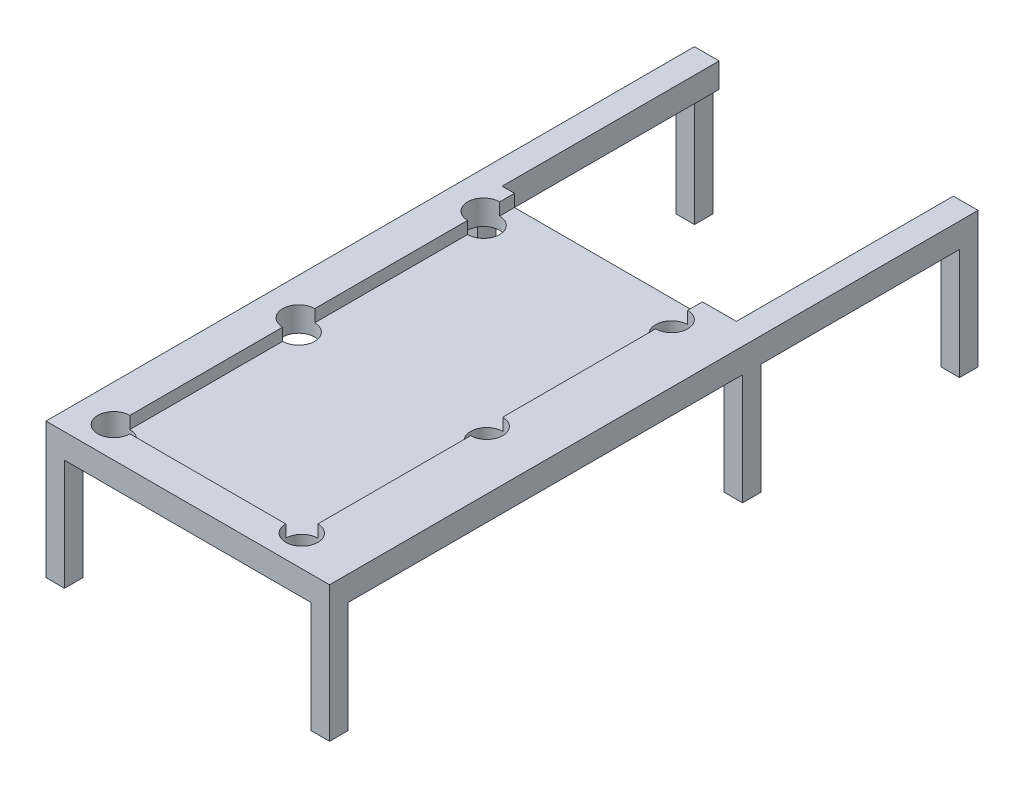
from build123d import *

# Parameters (mm, degrees)
SKETCH2_W           = 460
SKETCH2_H           = 700
SKETCH2_W_2         = 305
SKETCH2_H_2         = 600
BOSS_EXTRUDE1_DEPTH = 20
SKETCH10_W          = 460
SKETCH10_H          = 700
BOSS_EXTRUDE6_DEPTH = 20
SKETCH11_W          = 30
SKETCH11_H          = 30
BOSS_EXTRUDE7_DEPTH = 180
SKETCH14_W          = 40
SKETCH14_H          = 352
BOSS_EXTRUDE8_DEPTH = 40
SKETCH15_W          = 30
SKETCH15_H          = 30
BOSS_EXTRUDE9_DEPTH = 180
SKETCH17_R          = 26
CUT_EXTRUDE1_DEPTH  = 60
CUT_EXTRUDE2_DEPTH  = 20


with BuildPart() as part:
    # Sketch2 → Boss-Extrude1 (new body)
    with BuildSketch(Plane(origin=(0, 0, 0), x_dir=(1, 0, 0), z_dir=(0, 1, 0))):
        with Locations((230, 350)):
            Rectangle(SKETCH2_W, SKETCH2_H)
        with Locations((212.5, 350)):
            Rectangle(SKETCH2_W_2, SKETCH2_H_2, mode=Mode.SUBTRACT)
    extrude(amount=BOSS_EXTRUDE1_DEPTH)

    # Sketch10 → Boss-Extrude6 (add)
    with BuildSketch(Plane.XZ):
        with Locations((230, -350)):
            Rectangle(SKETCH10_W, SKETCH10_H)
    extrude(amount=BOSS_EXTRUDE6_DEPTH)

    # Sketch11 → Boss-Extrude7 (add)
    with BuildSketch(Plane.XZ.offset(20)):
        with Locations((15, -15)):
            Rectangle(SKETCH11_W, SKETCH11_H)
        with Locations((445, -15)):
            Rectangle(SKETCH11_W, SKETCH11_H)
        with Locations((15, -685)):
            Rectangle(SKETCH11_W, SKETCH11_H)
        with Locations((445, -685)):
            Rectangle(SKETCH11_W, SKETCH11_H)
    extrude(amount=BOSS_EXTRUDE7_DEPTH)

    # Sketch14 → Boss-Extrude8 (add)
    with BuildSketch(Plane(origin=(0, 20, 0), x_dir=(1, 0, 0), z_dir=(0, 1, 0))):
        with Locations((20, 876)):
            Rectangle(SKETCH14_W, SKETCH14_H)
        with Locations((440, 876)):
            Rectangle(SKETCH14_W, SKETCH14_H)
    extrude(amount=-BOSS_EXTRUDE8_DEPTH)

    # Sketch15 → Boss-Extrude9 (add)
    with BuildSketch(Plane.XZ.offset(20)):
        with Locations((445, -1037)):
            Rectangle(SKETCH15_W, SKETCH15_H)
        with Locations((15, -1037)):
            Rectangle(SKETCH15_W, SKETCH15_H)
    extrude(amount=BOSS_EXTRUDE9_DEPTH)

    # Sketch17 → Cut-Extrude1 (cut)
    with BuildSketch(Plane(origin=(0, 20, 0), x_dir=(1, 0, 0), z_dir=(0, 1, 0))):
        with Locations((60, 650)):
            Circle(SKETCH17_R)
        with Locations((365, 650)):
            Circle(SKETCH17_R)
        with Locations((60, 350)):
            Circle(SKETCH17_R)
        with Locations((365, 350)):
            Circle(SKETCH17_R)
        with Locations((60, 50)):
            Circle(SKETCH17_R)
        with Locations((365, 50)):
            Circle(SKETCH17_R)
    extrude(amount=-CUT_EXTRUDE1_DEPTH, mode=Mode.SUBTRACT)

    # Sketch18 → Cut-Extrude2 (cut)
    with BuildSketch(Plane(origin=(0, 20, 0), x_dir=(1, 0, 0), z_dir=(0, 1, 0))):
        Polygon((60, 700), (365, 700), (365, 650), (212.5, 650), (60, 650), align=None)
    extrude(amount=-CUT_EXTRUDE2_DEPTH, mode=Mode.SUBTRACT)


solid = part.part
